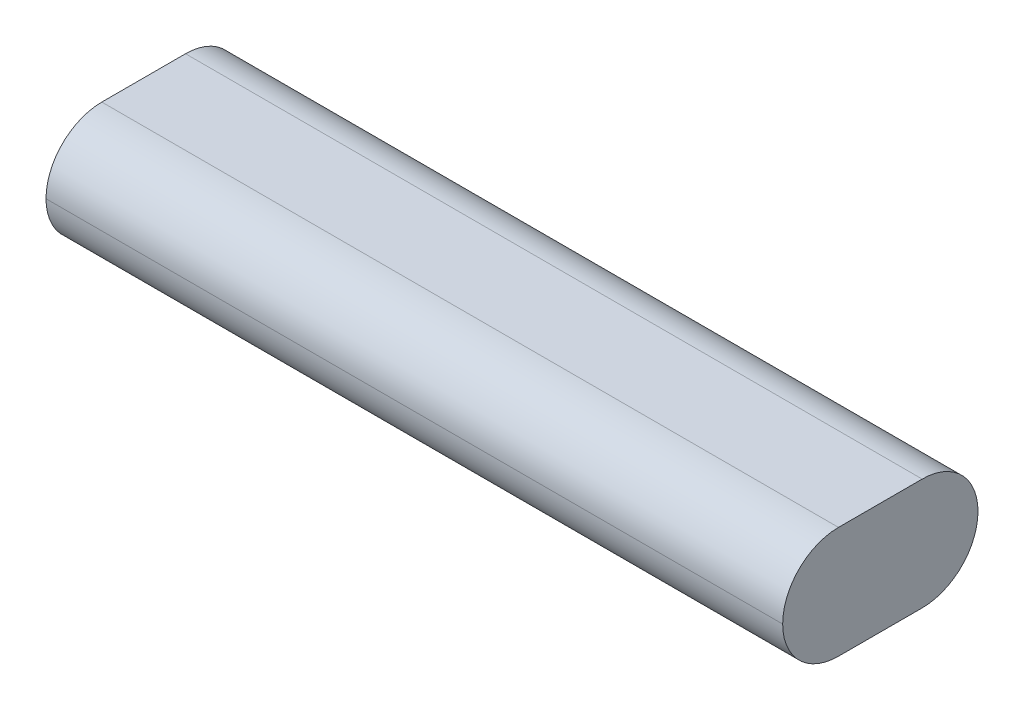
from build123d import *

# Parameters (mm, degrees)
SKETCH2_W           = 132
SKETCH2_H           = 35
BOSS_EXTRUDE1_DEPTH = 20
FILLET1_R           = 10


with BuildPart() as part:
    # Sketch2 → Boss-Extrude1 (new body)
    with BuildSketch(Plane(origin=(0, 0, 0), x_dir=(1, 0, 0), z_dir=(0, 1, 0))):
        with Locations((-21.769456002, -22.770691578)):
            Rectangle(SKETCH2_W, SKETCH2_H)
    extrude(amount=BOSS_EXTRUDE1_DEPTH)

    # Fillet1
    fillet1_edges = [part.edges().sort_by_distance(p)[0] for p in [
        (-21.769456002, 0, 40.270691578),
        (-21.769456002, 0, 5.270691578),
        (-21.769456002, 20, 5.270691578),
        (-21.769456002, 20, 40.270691578),
    ]]
    fillet(fillet1_edges, radius=FILLET1_R - 0.0001)  # a hair under: the kernel refuses the full size


solid = part.part
